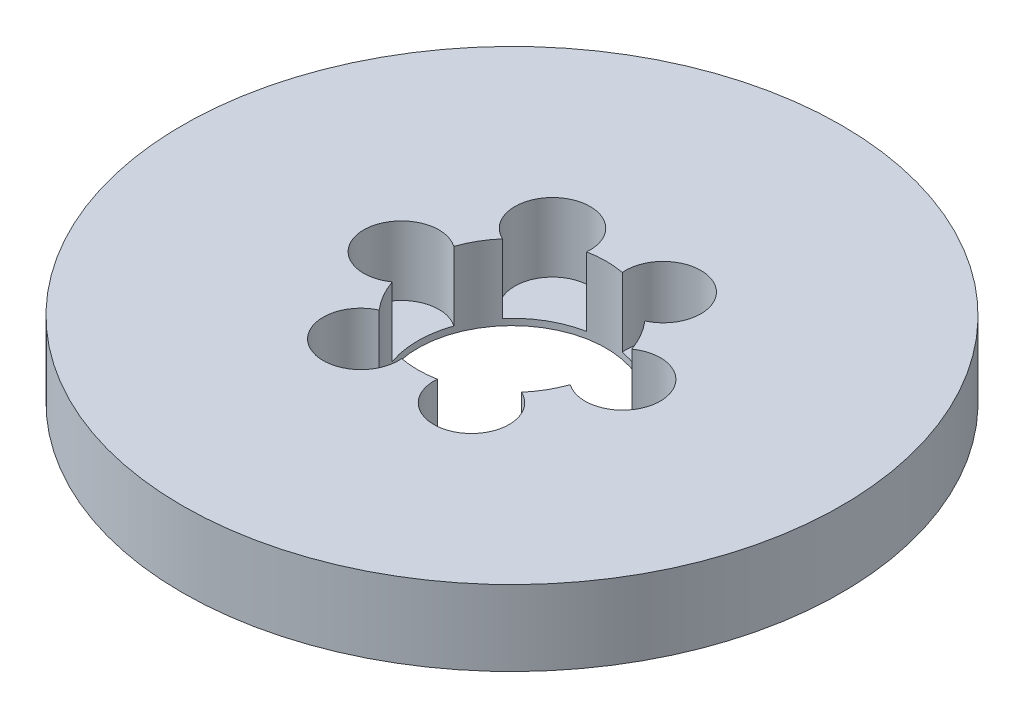
from build123d import *

# Parameters (mm, degrees)
SKETCH1_R           = 87.5
BOSS_EXTRUDE1_DEPTH = 20
SKETCH2_R           = 25
CUT_EXTRUDE1_DEPTH  = 126.349511367
SKETCH3_R           = 10
CUT_EXTRUDE2_DEPTH  = 18.298379086
CIRPATTERN1_COUNT   = 6


with BuildPart() as part:
    # Sketch1 → Boss-Extrude1 (new body)
    with BuildSketch(Plane(origin=(0, 0, 0), x_dir=(1, 0, 0), z_dir=(0, 1, 0))):
        Circle(SKETCH1_R)
    extrude(amount=BOSS_EXTRUDE1_DEPTH)

    # Sketch2 → Cut-Extrude1 (cut, through all)
    with BuildSketch(Plane(origin=(0, 0, 0), x_dir=(1, 0, 0), z_dir=(0, 1, 0))):
        Circle(SKETCH2_R)
    extrude(amount=CUT_EXTRUDE1_DEPTH, mode=Mode.SUBTRACT)

    # Sketch3 → Cut-Extrude2 (cut)
    with BuildSketch(Plane(origin=(0, 20, 0), x_dir=(1, 0, 0), z_dir=(0, 1, 0))):
        with Locations((-29.38501669, 0)):
            Circle(SKETCH3_R)
    cut_extrude2 = extrude(amount=-CUT_EXTRUDE2_DEPTH, mode=Mode.SUBTRACT)

    # CirPattern1: Cut-Extrude2 ×6 about axis
    cirpattern1_axis = Axis((0, 0, 0), (0, 1, 0))
    for i in range(1, CIRPATTERN1_COUNT):
        add(cut_extrude2.rotate(cirpattern1_axis, i * 360 / CIRPATTERN1_COUNT), mode=Mode.SUBTRACT)


solid = part.part
